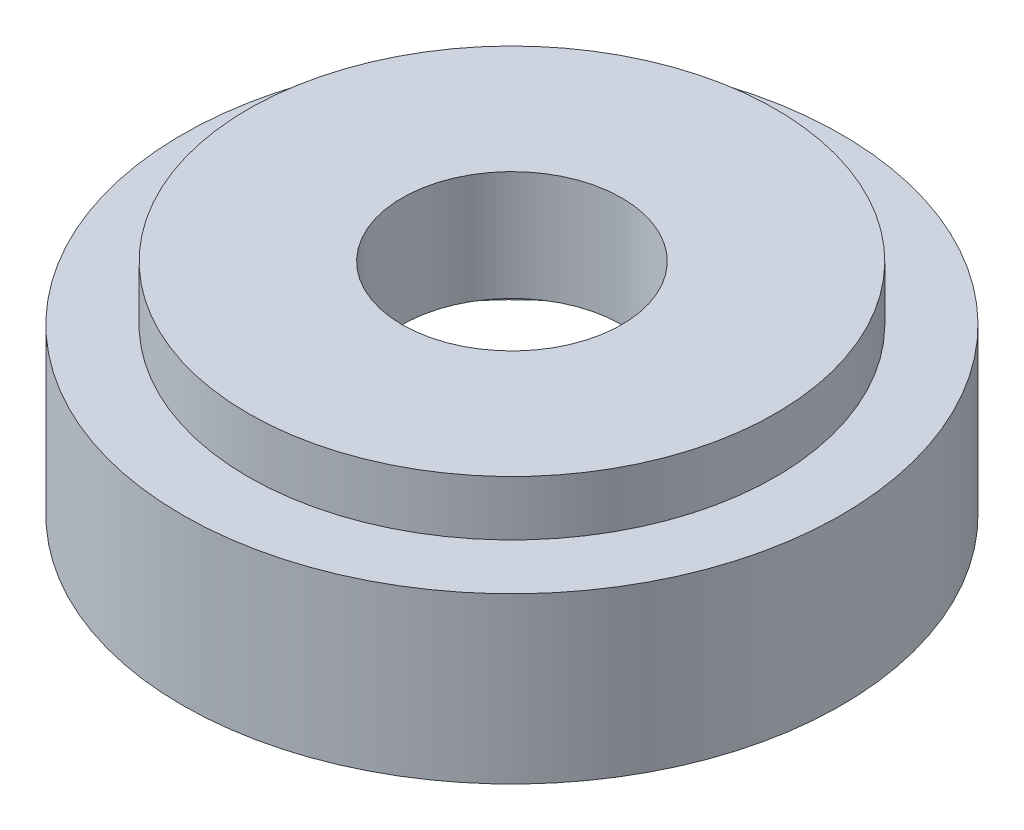
from build123d import *

# Parameters (mm, degrees)
CROQUIS1_R              = 24
CROQUIS1_R_2            = 10
SALIENTE_EXTRUIR1_DEPTH = 5
SALIENTE_EXTRUIR2_START = -5
CROQUIS1_3_R            = 30
CROQUIS1_3_R_2          = 10
SALIENTE_EXTRUIR2_DEPTH = 5
SALIENTE_EXTRUIR3_START = -15
CROQUIS1_4_R            = 30
CROQUIS1_4_R_2          = 24
SALIENTE_EXTRUIR3_DEPTH = 15


with BuildPart() as part:
    # Croquis1 → Saliente-Extruir1 (new body)
    with BuildSketch(Plane(origin=(0, 0, 0), x_dir=(1, 0, 0), z_dir=(0, 1, 0))):
        Circle(CROQUIS1_R)
        Circle(CROQUIS1_R_2, mode=Mode.SUBTRACT)
    extrude(amount=SALIENTE_EXTRUIR1_DEPTH)

    # Croquis1<3> → Saliente-Extruir2 (add)
    with BuildSketch(Plane(origin=(0, 0, 0), x_dir=(1, 0, 0), z_dir=(0, 1, 0)).offset(SALIENTE_EXTRUIR2_START)):
        Circle(CROQUIS1_3_R)
        Circle(CROQUIS1_3_R_2, mode=Mode.SUBTRACT)
    extrude(amount=SALIENTE_EXTRUIR2_DEPTH)

    # Croquis1<4> → Saliente-Extruir3 (add)
    with BuildSketch(Plane(origin=(0, 0, 0), x_dir=(1, 0, 0), z_dir=(0, 1, 0)).offset(SALIENTE_EXTRUIR3_START)):
        Circle(CROQUIS1_4_R)
        Circle(CROQUIS1_4_R_2, mode=Mode.SUBTRACT)
    extrude(amount=SALIENTE_EXTRUIR3_DEPTH)


solid = part.part
